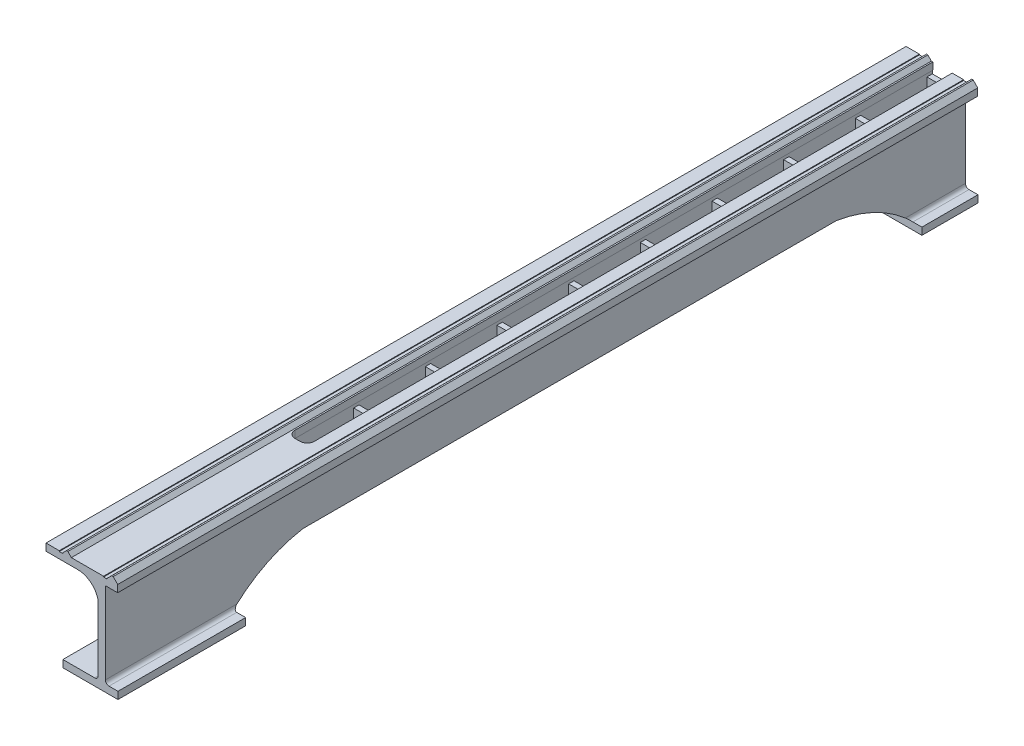
from build123d import *

# Parameters (mm, degrees)
BOSS_EXTRUDE1_DEPTH     = 1200
CUT_EXTRUDE1_DEPTH      = 800
CUT_EXTRUDE2_START      = -300
SKETCH3_W               = 36.203926591
SKETCH3_H               = 13.184166836
CUT_EXTRUDE2_DEPTH      = 900
SKETCH5_W               = 10.426623187
SKETCH5_H               = 125.292137731
BOSS_EXTRUDE2_DEPTH     = 1100
SKETCH6_W               = 7.435137382
SKETCH6_H               = 64.029540506
BOSS_EXTRUDE3_DEPTH     = 50
LPATTERN1_COUNT         = 10
LPATTERN1_PITCH         = 100
CUT_EXTRUDE3_DEPTH      = 10
CUT_EXTRUDE3_DEPTH_BACK = 100


with BuildPart() as part:
    # Sketch1 → Boss-Extrude1 (new body)
    with BuildSketch(Plane.XY):
        with BuildLine():
            Line((-31.555119126, 31.290150882), (-37.853807036, 37.718722311))
            Line((-37.853807036, 37.718722311), (-39.853807036, 37.718722311))
            Line((-39.853807036, 37.718722311), (-46.282378465, 31.420034401))
            Line((-46.282378465, 31.420034401), (-46.282378465, 30.420034401))
            Line((-46.282378465, 30.420034401), (-51.282378465, 30.420034401))
            Line((-51.282378465, 30.420034401), (-51.282378465, 31.420034401))
            Line((-51.282378465, 31.420034401), (-96.206307824, 31.420034401))
            Line((-96.206307824, 31.420034401), (-101.105287309, 36.420034401))
            Line((-101.105287309, 36.420034401), (-103.105287309, 36.420034401))
            Line((-103.105287309, 36.420034401), (-108.055034777, 31.470286932))
            Line((-108.055034777, 31.470286932), (-108.055034777, 30.420034401))
            Line((-108.055034777, 30.420034401), (-113.055034777, 30.420034401))
            Line((-113.055034777, 30.420034401), (-113.055034777, 31.420034401))
            Line((-113.055034777, 31.420034401), (-131.555034777, 31.420034401))
            Line((-131.555034777, 31.420034401), (-131.555034777, 21.420034401))
            Line((-131.555034777, 21.420034401), (-87.349569261, 21.420034401))
            ThreePointArc((-87.349569261, 21.420034401), (-68.862935324, 14.835575372), (-58.701074529, -1.95273366))
            Line((-58.701074529, -1.95273366), (-58.701074529, -92.579965599))
            ThreePointArc((-58.701074529, -92.579965599), (-60.165540623, -96.115499505), (-63.701074529, -97.579965599))
            Line((-63.701074529, -97.579965599), (-108.009983562, -97.579965599))
            Line((-108.009983562, -97.579965599), (-108.009983562, -107.579965599))
            Line((-108.009983562, -107.579965599), (-31.195424592, -107.579965599))
            Line((-31.195424592, -107.579965599), (-31.195424592, -97.579965599))
            Line((-31.195424592, -97.579965599), (-43.701074529, -97.579965599))
            ThreePointArc((-43.701074529, -97.579965599), (-47.236608435, -96.115499505), (-48.701074529, -92.579965599))
            Line((-48.701074529, -92.579965599), (-48.701074529, 21.290150882))
            Line((-48.701074529, 21.290150882), (-31.555119126, 21.290150882))
            Line((-31.555119126, 21.290150882), (-31.555119126, 31.290150882))
        make_face()
    extrude(amount=BOSS_EXTRUDE1_DEPTH)

    # Sketch2 → Cut-Extrude1 (cut)
    with BuildSketch(Plane(origin=(0, 20.764722339, 0), x_dir=(1, 0, 0), z_dir=(0, 1, 0))):
        with BuildLine():
            Line((-84.170689991, 100), (-77.170689991, 100))
            ThreePointArc((-77.170689991, 100), (-70.099622179, 97.071067812), (-67.170689991, 90))
            Line((-67.170689991, 90), (-67.170689991, -890))
            ThreePointArc((-67.170689991, -890), (-70.099622179, -897.071067812), (-77.170689991, -900))
            Line((-77.170689991, -900), (-84.170689991, -900))
            ThreePointArc((-84.170689991, -900), (-91.241757803, -897.071067812), (-94.170689991, -890))
            Line((-94.170689991, -890), (-94.170689991, 90))
            ThreePointArc((-94.170689991, 90), (-91.241757803, 97.071067812), (-84.170689991, 100))
        make_face()
    extrude(amount=CUT_EXTRUDE1_DEPTH, mode=Mode.SUBTRACT)

    # Sketch3 → Cut-Extrude2 (cut)
    with BuildSketch(Plane.XY.offset(1200).offset(CUT_EXTRUDE2_START)):
        with Locations((-75.865548737, 14.689788087)):
            Rectangle(SKETCH3_W, SKETCH3_H)
    extrude(amount=-CUT_EXTRUDE2_DEPTH, mode=Mode.SUBTRACT)

    # Sketch5 → Boss-Extrude2 (add)
    with BuildSketch(Plane(origin=(0, 0, 0), x_dir=(-1, 0, 0), z_dir=(0, 0, -1))):
        with Locations((100.133130522, -34.849417223)):
            Rectangle(SKETCH5_W, SKETCH5_H)
    extrude(amount=-BOSS_EXTRUDE2_DEPTH)

    # Sketch6 → Boss-Extrude3 (add)
    with BuildSketch(Plane.ZY.offset(105.346442115)):
        with Locations((3.717568691, -15.430068515)):
            Rectangle(SKETCH6_W, SKETCH6_H)
    boss_extrude3 = extrude(amount=-BOSS_EXTRUDE3_DEPTH)

    # LPattern1: Boss-Extrude3 ×10
    with Locations(*[(0, 0, i * LPATTERN1_PITCH) for i in range(1, LPATTERN1_COUNT)]):
        add(boss_extrude3)

    # Sketch4 → Cut-Extrude3 (cut, two sides: drawn at the far end of the back side and taken through both)
    with BuildSketch(Plane(origin=(-31.555119126, 0, 0), x_dir=(0, 0, -1), z_dir=(1, 0, 0)).offset(-CUT_EXTRUDE3_DEPTH_BACK)):
        with BuildLine():
            Line((-1021.794598087, -97.579965599), (-1021.794598087, -107.579965599))
            Line((-1021.794598087, -107.579965599), (-1021.794598087, -177.956634241))
            Line((-1021.794598087, -177.956634241), (-78.251558955, -177.956634241))
            Line((-78.251558955, -177.956634241), (-78.251558955, -97.579965599))
            ThreePointArc((-78.251558955, -97.579965599), (-125.439551095, -65.003483773), (-180.068799532, -47.579965599))
            Line((-180.068799532, -47.579965599), (-924.318449906, -47.579965599))
            ThreePointArc((-924.318449906, -47.579965599), (-976.879901936, -65.126202507), (-1021.794598087, -97.579965599))
        make_face()
    extrude(amount=CUT_EXTRUDE3_DEPTH + CUT_EXTRUDE3_DEPTH_BACK, mode=Mode.SUBTRACT)


solid = part.part
